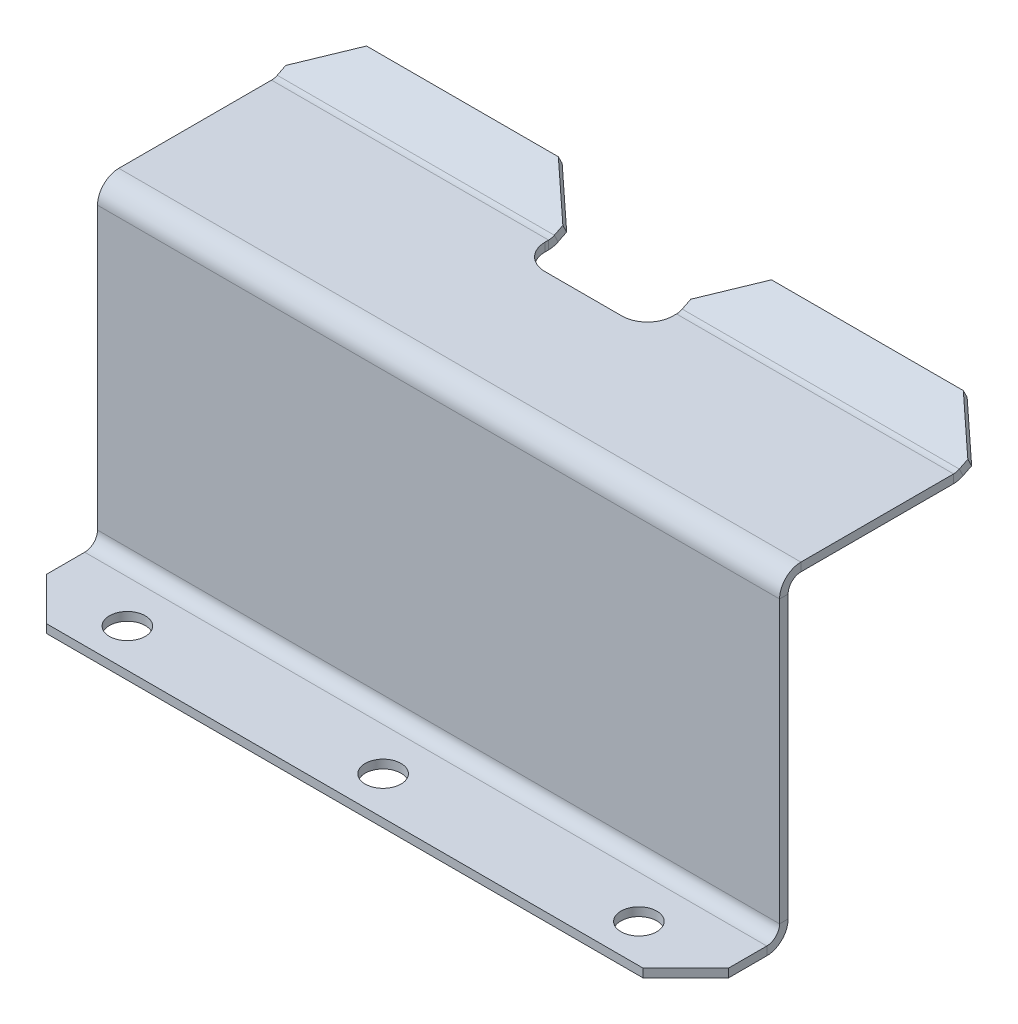
from build123d import *

# Parameters (mm, degrees)
BASE_FLANGE1_DEPTH       = 80
SKETCH7_R                = 2.1
CUT_EXTRUDE2_DEPTH       = 94.099760047
LPATTERN1_COUNT          = 2
LPATTERN1_PITCH          = 30
LPATTERN1_COL_COUNT      = 2
LPATTERN1_COL_PITCH      = 30
CUT_EXTRUDE_1_DEPTH      = 93.303846074
CUT_EXTRUDE_1_DEPTH_BACK = 93.303846074
SKETCH_1_W               = 15
SKETCH_1_H               = 10
CHAMFER_1_SIZE           = 5
FILLET_1_R               = 3


# Read off the part's stored shape, not the designer's step: Base-Flange1
with BuildPart() as part:
    # Base-Flange1 outline → Base-Flange1 (new body)
    with BuildSketch(Plane(origin=(0, 0, 0), x_dir=(0, 0, -1), z_dir=(1, 0, 0))):
        with BuildLine():
            Line((-2.5, -17.5), (-12, -17.5))
            Line((-12, -17.5), (-12, -18.5))
            Line((-12, -18.5), (-2.5, -18.5))
            ThreePointArc((-2.5, -18.5), (-0.732233047, -17.767766953), (0, -16))
            Line((0, -16), (0, 17))
            ThreePointArc((0, 17), (0.439339828, 18.060660172), (1.5, 18.5))
            Line((1.5, 18.5), (19.409830056, 18.5))
            ThreePointArc((19.409830056, 18.5), (19.984212358, 18.566877526), (20.527864045, 18.763932023))
            Line((20.527864045, 18.763932023), (26, 21.5))
            Line((26, 21.5), (25.552786405, 22.394427191))
            Line((25.552786405, 22.394427191), (20.08065045, 19.658359214))
            ThreePointArc((20.08065045, 19.658359214), (19.754459437, 19.540126516), (19.409830056, 19.5))
            Line((19.409830056, 19.5), (1.5, 19.5))
            ThreePointArc((1.5, 19.5), (-0.267766953, 18.767766953), (-1, 17))
            Line((-1, 17), (-1, -16))
            ThreePointArc((-1, -16), (-1.439339828, -17.060660172), (-2.5, -17.5))
        make_face()
    extrude(amount=BASE_FLANGE1_DEPTH)

    # Sketch7 → Cut-Extrude2 (cut, through all)
    with BuildSketch(Plane(origin=(0, -17.5, 0), x_dir=(1, 0, 0), z_dir=(0, 1, 0))):
        with Locations(Location((40, -7.5, 0), (0, 0, 270))):
            Circle(SKETCH7_R)
    cut_extrude2 = extrude(amount=-CUT_EXTRUDE2_DEPTH, mode=Mode.SUBTRACT)

    # LPattern1: Cut-Extrude2 ×2
    with Locations(*[(i * LPATTERN1_PITCH, 0, 0) for i in range(1, LPATTERN1_COUNT)]):
        add(cut_extrude2, mode=Mode.SUBTRACT)

    # LPattern1 col: Cut-Extrude2 ×2
    with Locations(*[(-i * LPATTERN1_COL_PITCH, 0, 0) for i in range(1, LPATTERN1_COL_COUNT)]):
        add(cut_extrude2, mode=Mode.SUBTRACT)

    # Sketch 1 → 除料-伸長1 (cut, two sides: drawn at the far end of the back side and taken through both)
    with BuildSketch(Plane(origin=(0, 19.5, 0), x_dir=(1, 0, 0), z_dir=(0, 1, 0)).offset(-CUT_EXTRUDE_1_DEPTH_BACK)):
        with Locations((40, 21)):
            Rectangle(SKETCH_1_W, SKETCH_1_H)
    extrude(amount=CUT_EXTRUDE_1_DEPTH + CUT_EXTRUDE_1_DEPTH_BACK, mode=Mode.SUBTRACT)

    # 導角1
    chamfer_1_edges = [part.edges().sort_by_distance(p)[0] for p in [
        (32.5, 21.947213595, -25.776393202),
        (47.5, 21.947213595, -25.776393202),
        (0, 21.947213595, -25.776393202),
        (0, -18, 12),
        (80, 21.947213595, -25.776393202),
        (80, -18, 12),
    ]]
    chamfer(chamfer_1_edges, length=CHAMFER_1_SIZE)

    # 圓角1
    fillet_1_edges = [part.edges().sort_by_distance(p)[0] for p in [
        (32.5, 19, -16),
        (47.5, 19, -16),
    ]]
    fillet(fillet_1_edges, radius=FILLET_1_R)


solid = part.part
